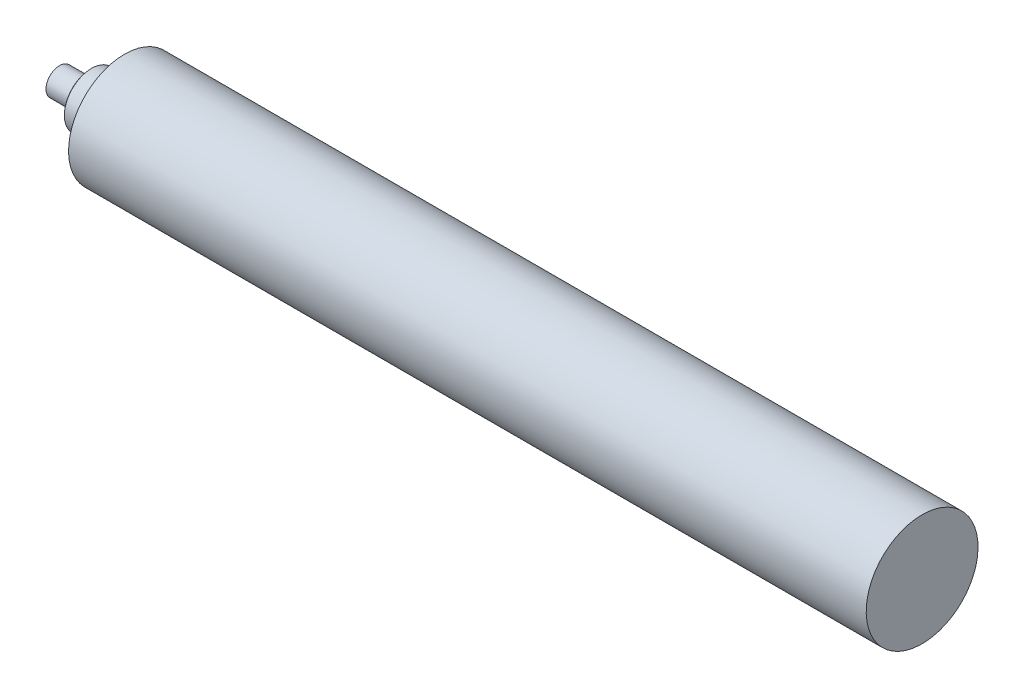
from build123d import *

# Parameters (mm, degrees)
SKETCH19_R         = 6.556375
CUT_EXTRUDE3_DEPTH = 25.4
THREAD2_PITCH      = 2.116666667


with BuildPart() as part:
    # Sketch1 → Revolve1 (revolve)
    with BuildSketch(Plane.XY):
        with BuildLine():
            Line((0, 0), (0, 11.938))
            Line((0, 11.938), (24.765, 11.938))
            ThreePointArc((24.765, 11.938), (26.561051224, 12.681948776), (27.305, 14.478))
            Line((27.305, 14.478), (27.305, 22.933028409))
            Line((27.305, 22.933028409), (28.104406531, 23.876))
            Line((28.104406531, 23.876), (57.15, 23.876))
            Line((57.15, 23.876), (57.15, 49.2125))
            Line((57.15, 49.2125), (759.206, 49.2125))
            Line((759.206, 49.2125), (759.206, 0))
            Line((759.206, 0), (0, 0))
        make_face()
    revolve(axis=Axis((759.206, 0, 0), (-1, 0, 0)))

    # Sketch16 → Cut-Revolve1 (revolve, cut)
    with BuildSketch(Plane(origin=(0, 0, 0), x_dir=(1, 0, 0), z_dir=(0, 1, 0))):
        Polygon((0, 0), (0, 8.35025), (1.905, 6.556375), (1.905, 0), align=None)
    revolve(axis=Axis((1.905, 0, 0), (-1, 0, 0)), mode=Mode.SUBTRACT)

    # Sketch19 → Cut-Extrude3 (cut)
    with BuildSketch(Plane.ZY.offset(-1.905)):
        Circle(SKETCH19_R)
    extrude(amount=-CUT_EXTRUDE3_DEPTH, mode=Mode.SUBTRACT)

    # Thread2: the profile of Thread Profile4 profile screwed along a right-hand helix of 12 turns, 10 arcs to a turn; built about Z, then put on its axis
    thread2_z = Axis((0, 0, 0), (0, 0, 1))
    thread2_corners = [(6.556075, 0, -0.000173205), (7.702054435, 0, 0.66145833), (7.702054435, 0, 0.926041664), (6.556075, 0, 1.587673199)]
    with BuildLine(mode=Mode.PRIVATE) as thread2_profile:
        Line(thread2_corners[0], thread2_corners[1])
        Line(thread2_corners[1], thread2_corners[2])
        Line(thread2_corners[2], thread2_corners[3])
        Line(thread2_corners[3], thread2_corners[0])
    thread2_cap = Face(thread2_profile.wire())
    thread2_turn_angles = [0, 18, 36, 54, 72, 90, 108, 126, 144, 162, 180, 198, 216, 234, 252, 270, 288, 306, 324, 342, 360]
    thread2_turn_weights = [1, 0.9510565162951535, 1, 0.9510565162951535, 1, 0.9510565162951535, 1, 0.9510565162951535, 1, 0.9510565162951535, 1, 0.9510565162951535, 1, 0.9510565162951535, 1, 0.9510565162951535, 1, 0.9510565162951535, 1, 0.9510565162951535, 1]
    thread2_turn_rails = [Edge.make_bspline([Vector(p[0], p[1], 0).rotate(thread2_z, thread2_turn_angles[k]) / thread2_turn_weights[k] + Vector(0, 0, p[2] + THREAD2_PITCH * thread2_turn_angles[k] / 360) for k in range(21)], [0, 0, 0, 1, 1, 2, 2, 3, 3, 4, 4, 5, 5, 6, 6, 7, 7, 8, 8, 9, 9, 10, 10, 10], 2, thread2_turn_weights) for p in thread2_corners]
    thread2_turn_sides = [Face.make_surface_from_curves(thread2_turn_rails[p[0]], thread2_turn_rails[p[1]]) for p in [(0, 1), (1, 2), (2, 3), (3, 0)]]
    thread2 = Plane(origin=(1.905, 0, 0), x_dir=(0, 0, -1), z_dir=(1, 0, 0)) * Solid(Shell([*[p.moved(Location((0, 0, THREAD2_PITCH * i))) for i in range(12) for p in thread2_turn_sides], thread2_cap, thread2_cap.rotate(thread2_z, 4320).moved(Location((0, 0, THREAD2_PITCH * 4320 / 360)))]))
    add(thread2, mode=Mode.SUBTRACT)

    # Sketch32 → Cut-Revolve6 (revolve, cut)
    with BuildSketch(Plane(origin=(0, 0, 0), x_dir=(1, 0, 0), z_dir=(0, 1, 0)), mode=Mode.PRIVATE) as cut_revolve6_sk:
        Polygon((27.305, 0), (28.575, 0), (27.305, 6.351059428), align=None)
    revolve(cut_revolve6_sk.sketch.rotate(Axis((27.305, 0, 0), (1, 0, 0)), 180), axis=Axis((27.305, 0, 0), (1, 0, 0)), mode=Mode.SUBTRACT)


solid = part.part
